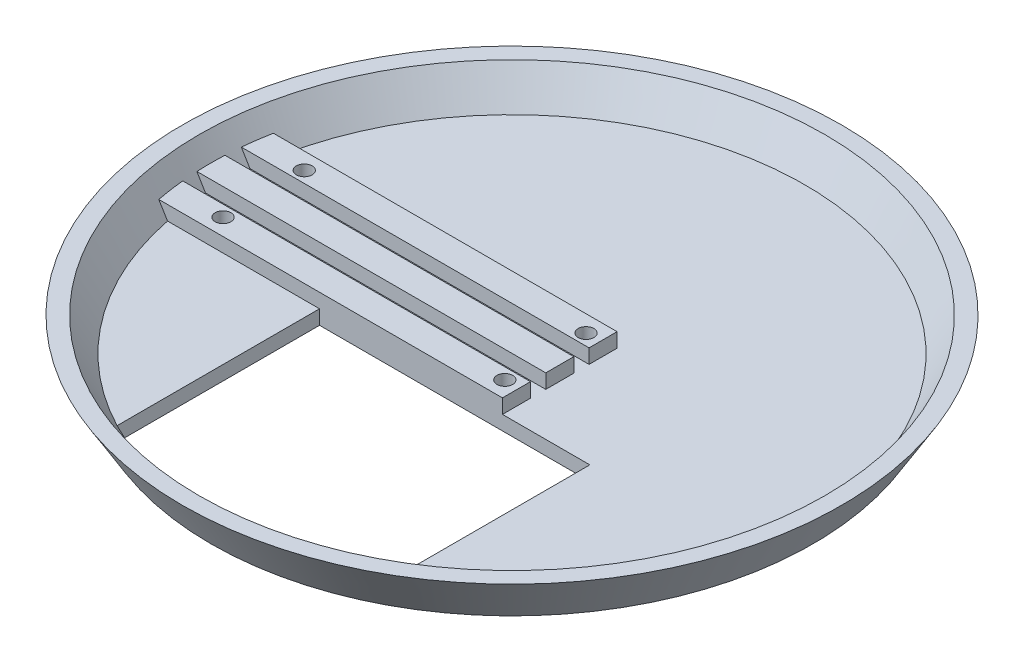
from build123d import *

# Parameters (mm, degrees)
CUT_EXTRUDE1_DEPTH       = 98.831487774
BOSS_EXTRUDE1_DEPTH      = 10
BOSS_EXTRUDE1_DEPTH_BACK = 63.5
SKETCH4_W                = 5.866666667
SKETCH4_H                = 3
SKETCH4_W_2              = 5.866666666
SKETCH5_R                = 1.65
CUT_EXTRUDE2_DEPTH       = 99.091793744


with BuildPart() as part:
    # Sketch1 → Revolve1 (revolve)
    with BuildSketch(Plane.XY):
        Polygon((0, 0), (63, 0), (69, 10), (65.501428863, 10), (61.301428863, 3), (0, 3), align=None)
    revolve(axis=Axis((0, 0, 0), (0, 1, 0)))

    # Sketch2 → Cut-Extrude1 (cut, through all)
    with BuildSketch(Plane(origin=(0, 3, 0), x_dir=(1, 0, 0), z_dir=(0, 1, 0))):
        with BuildLine():
            Line((-28.3, -12), (-28.3, -54.378076287))
            ThreePointArc((-28.3, -54.378076287), (0, -61.301428863), (28.3, -54.378076287))
            Line((28.3, -54.378076287), (28.3, -12))
            Line((28.3, -12), (-28.3, -12))
        make_face()
    extrude(amount=-CUT_EXTRUDE1_DEPTH, mode=Mode.SUBTRACT)

    # Sketch4 → Boss-Extrude1 (add, two sides: drawn at the far end of the back side and taken through both)
    with BuildSketch(Plane(origin=(0, 0, 0), x_dir=(0, 0, -1), z_dir=(1, 0, 0)).offset(-BOSS_EXTRUDE1_DEPTH_BACK)):
        with Locations((-9.066666666, 4.5)):
            Rectangle(SKETCH4_W, SKETCH4_H)
        with Locations((0, 4.5)):
            Rectangle(SKETCH4_W_2, SKETCH4_H)
        with Locations((9.066666666, 4.5)):
            Rectangle(SKETCH4_W, SKETCH4_H)
    extrude(amount=BOSS_EXTRUDE1_DEPTH + BOSS_EXTRUDE1_DEPTH_BACK)

    # Sketch5 → Cut-Extrude2 (cut, through all)
    with BuildSketch(Plane(origin=(0, 0, 0), x_dir=(1, 0, 0), z_dir=(0, 1, 0))):
        with Locations((7, -8.5)):
            Circle(SKETCH5_R)
        with Locations((7, 8.5)):
            Circle(SKETCH5_R)
        with Locations((-52, 8.5)):
            Circle(SKETCH5_R)
        with Locations((-52, -8.5)):
            Circle(SKETCH5_R)
    extrude(amount=CUT_EXTRUDE2_DEPTH, mode=Mode.SUBTRACT)


solid = part.part
